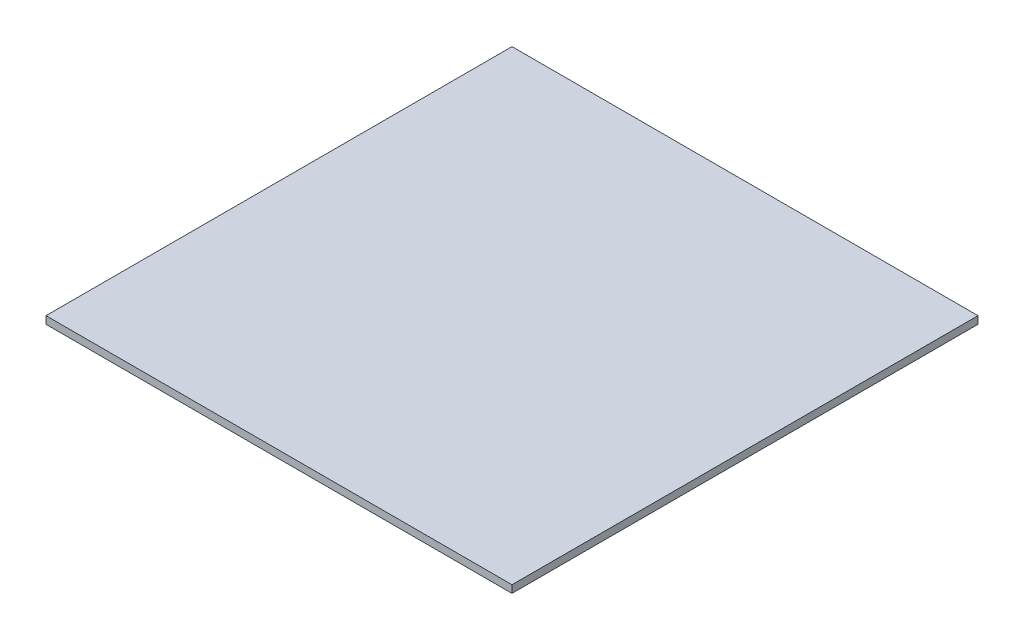
from build123d import *

# Parameters (mm, degrees)
SKETCH1_W           = 99.2004
SKETCH1_H           = 99.2004
BOSS_EXTRUDE1_DEPTH = 1.6002


with BuildPart() as part:
    # Sketch1 → Boss-Extrude1 (new body)
    with BuildSketch(Plane(origin=(0, 0, 0), x_dir=(1, 0, 0), z_dir=(0, 1, 0))):
        with Locations((49.6002, 49.6002)):
            Rectangle(SKETCH1_W, SKETCH1_H)
    extrude(amount=BOSS_EXTRUDE1_DEPTH)


solid = part.part
